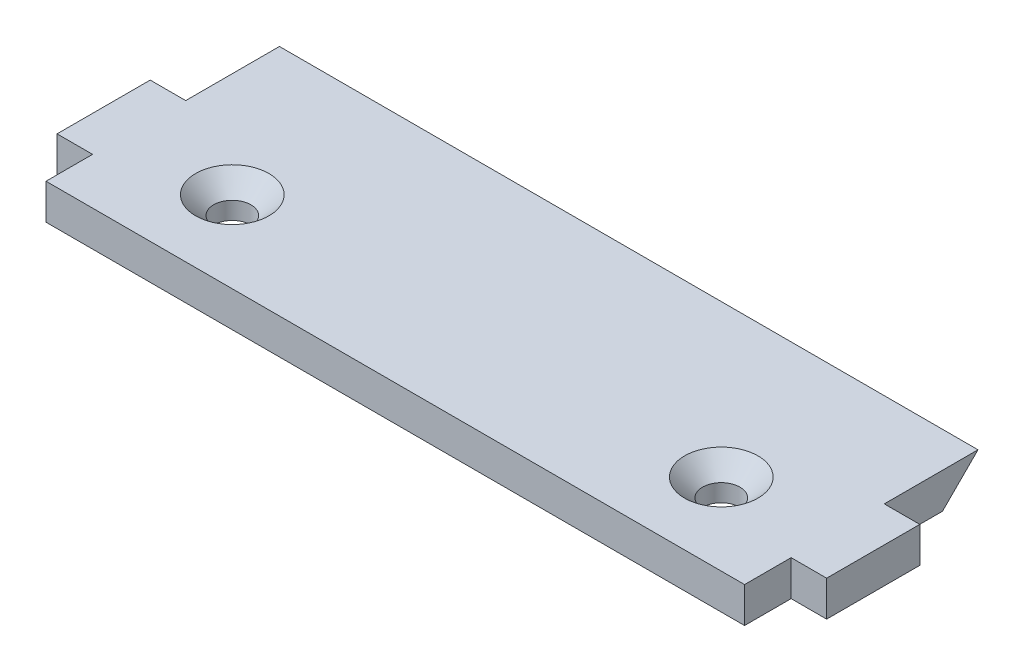
from build123d import *

# Parameters (mm, degrees)
SKETCH1_R           = 1.5
BOSS_EXTRUDE1_DEPTH = 3.05
CUT_EXTRUDE1_DEPTH  = 67.231469106


with BuildPart() as part:
    # Sketch1 → Boss-Extrude1 (new body)
    with BuildSketch(Plane(origin=(0, 0, 0), x_dir=(1, 0, 0), z_dir=(0, 1, 0))):
        Polygon((3.05, 20.05), (3.05, 12), (0, 12), (0, 4), (3.05, 4), (3.05, 0), (63.05, 0), (63.05, 4), (66.1, 4), (66.1, 12), (63.05, 12), (63.05, 20.05), align=None)
        with Locations((54.05, 7)):
            Circle(SKETCH1_R, mode=Mode.SUBTRACT)
        with Locations((12.05, 7)):
            Circle(SKETCH1_R, mode=Mode.SUBTRACT)
    extrude(amount=BOSS_EXTRUDE1_DEPTH)

    # Sketch5 → CSK for M3 Flat Head Machine Screw1 (revolve, cut)
    with BuildSketch(Plane(origin=(12.05, 3.05, -7), x_dir=(0, 0, 1), z_dir=(1, 0, 0))):
        Polygon((0, 0), (0, 3.05), (1.6, 3.05), (1.6, 1.55), (3.15, 0), align=None)
    revolve(axis=Axis((12.05, 9.4, -7), (0, -1, 0)), mode=Mode.SUBTRACT)

    # Sketch7 → CSK for M3 Flat Head Machine Screw2 (revolve, cut)
    with BuildSketch(Plane(origin=(54.05, 3.05, -7), x_dir=(0, 0, 1), z_dir=(1, 0, 0))):
        Polygon((0, 0), (0, 3.05), (1.6, 3.05), (1.6, 1.55), (3.15, 0), align=None)
    revolve(axis=Axis((54.05, 9.4, -7), (0, -1, 0)), mode=Mode.SUBTRACT)

    # Sketch8 → Cut-Extrude1 (cut, through all)
    with BuildSketch(Plane(origin=(63.05, 0, 0), x_dir=(0, 0, -1), z_dir=(1, 0, 0))):
        Polygon((20.05, 3.05), (17, 0), (20.05, 0), align=None)
    extrude(amount=-CUT_EXTRUDE1_DEPTH, mode=Mode.SUBTRACT)


solid = part.part
